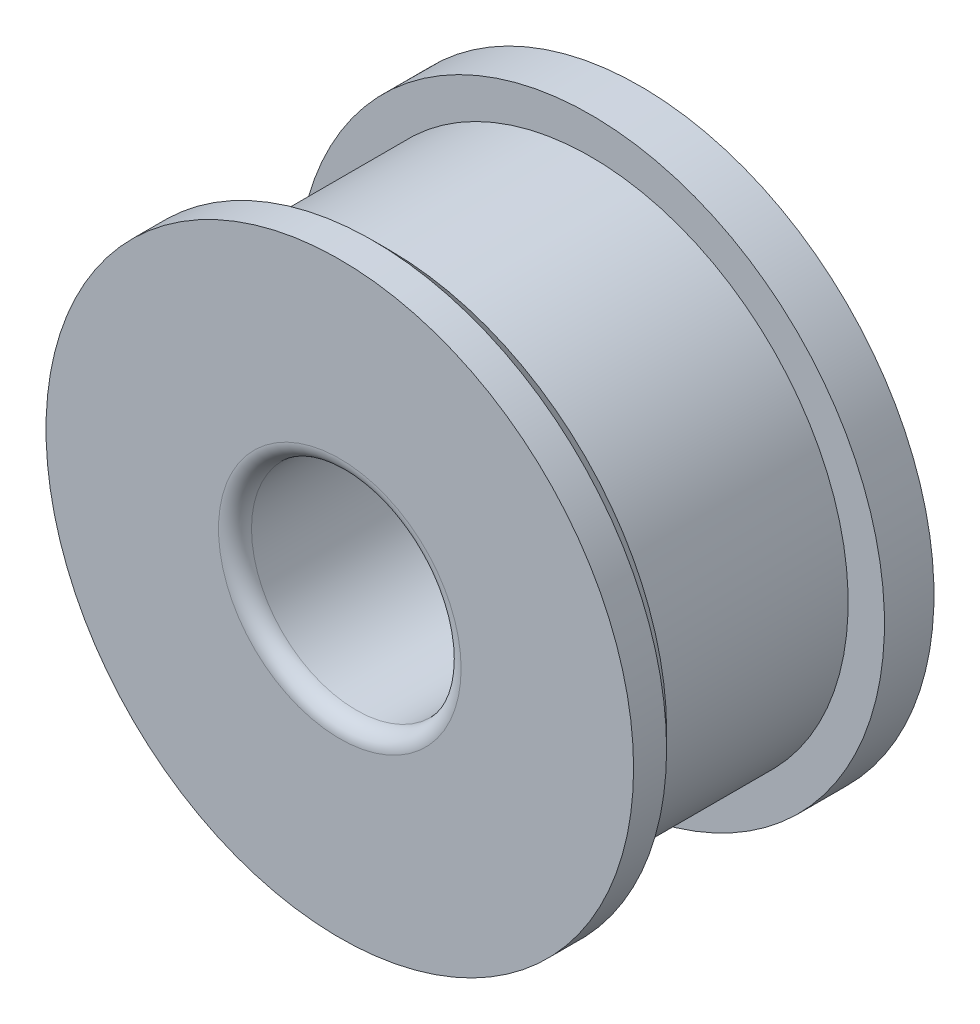
from build123d import *
from OCP.BRepFilletAPI import BRepFilletAPI_MakeChamfer

# Parameters (mm, degrees)
ESBO_O1_W                  = 97.4
ESBO_O1_H                  = 1.25
RESSALTO_EXTRUS_O1_DEPTH   = 6.2
ESBO_O2_W                  = 97.4
ESBO_O2_H                  = 1.25
RESSALTO_EXTRUS_O2_DEPTH   = 40.6
FILETE1_R                  = 1
ESBO_O3_R                  = 2
ESBO_O3_R_2                = 2.5
ESBO_O3_R_3                = 6
ESBO_O3_W                  = 4
ESBO_O3_H                  = 6
ESBO_O3_W_2                = 6
ESBO_O3_H_2                = 8
CORTE_EXTRUS_O1_DEPTH      = 40.6
ESBO_O6_R                  = 3
RESSALTO_EXTRUS_O3_DEPTH   = 22.5
ESBO_O7_R                  = 2.25
RESSALTO_EXTRUS_O4_DEPTH   = 12.3
FILETE2_R                  = 0.25
ESBO_O12_R                 = 4
RESSALTO_EXTRUS_O7_DEPTH   = 3
ESBO_O13_R                 = 4.5
RESSALTO_EXTRUS_O8_DEPTH   = 8.1
ESBO_O8_R                  = 16.365
ESBO_O8_R_2                = 2.3
RESSALTO_EXTRUS_O5_DEPTH   = 4
ESBO_O9_R                  = 4
ESBO_O9_R_2                = 2.3
RESSALTO_EXTRUS_O6_DEPTH   = 8.9
ESBO_O10_R                 = 13.865
ESBO_O10_R_2               = 4.9
CORTE_EXTRUS_O2_DEPTH      = 1
CORTE_EXTRUS_O3_START      = -1
ESBO_O11_R                 = 13.86
ESBO_O11_R_2               = 4.9
CORTE_EXTRUS_O3_DEPTH      = 1
ESBO_O14_R                 = 18.34
ESBO_O14_R_2               = 3.1
RESSALTO_EXTRUS_O9_DEPTH   = 4
ESBO_O15_R                 = 7.8
ESBO_O15_R_2               = 3.1
RESSALTO_EXTRUS_O10_DEPTH  = 11.6
RESSALTO_EXTRUS_O11_START  = -1.5
ESBO_O16_R                 = 8.9
ESBO_O16_R_2               = 3.1
RESSALTO_EXTRUS_O11_DEPTH  = 1.5
CHANFRO1_SIZE              = 0.5
ESBO_O17_R                 = 3.5
ESBO_O17_R_2               = 3.1
RESSALTO_EXTRUS_O12_DEPTH  = 0.5
CORTE_EXTRUS_O4_START      = -1
ESBO_O18_R                 = 15.84
ESBO_O18_R_2               = 8.9
CORTE_EXTRUS_O4_DEPTH      = 1
ESBO_O19_R                 = 15.825
ESBO_O19_R_2               = 8.9
CORTE_EXTRUS_O5_DEPTH      = 1
RESSALTO_EXTRUS_O13_DEPTH  = 0.5
ESBO_O21_R                 = 1.75
RESSALTO_EXTRUS_O14_DEPTH  = 0.92
ESBO_O23_R                 = 17.675026778
RESSALTO_EXTRUS_O15_DEPTH  = 15
FILETE4_R                  = 1
ESBO_O24_R                 = 2.05
ESBO_O24_R_2               = 1.75
RESSALTO_EXTRUS_O16_DEPTH  = 1
ESBO_O25_R                 = 2.5
RESSALTO_EXTRUS_O17_DEPTH  = 0.1
ESBO_O26_R                 = 1
RESSALTO_EXTRUS_O18_DEPTH  = 0.5
FILETE6_R                  = 0.1
ESBO_O27_R                 = 4.99
RESSALTO_EXTRUS_O19_DEPTH  = 16.57
RESSALTO_EXTRUS_O20_START  = -25
ESBO_O28_R                 = 1
RESSALTO_EXTRUS_O20_DEPTH  = 25
FILETE5_R                  = 0.25
ESBO_O29_R                 = 3.59
RESSALTO_EXTRUS_O21_DEPTH  = 6
ESBO_O30_R                 = 2.7
RESSALTO_EXTRUS_O22_DEPTH  = 2
FILETE7_R                  = 1.4
CORTE_EXTRUS_O6_DEPTH      = 1.4
ESBO_O32_R                 = 1.75
RESSALTO_EXTRUS_O23_DEPTH  = 7.8
CHANFRO2_SIZE              = 1
CHANFRO2_SIZE2             = 0.466307658
RESSALTO_EXTRUS_O24_DEPTH  = 10
ESBO_O34_R                 = 2
RESSALTO_EXTRUS_O25_DEPTH  = 5
ESBO_O35_R                 = 7.8
RESSALTO_EXTRUS_O26_DEPTH  = 7.6
ESBO_O37_R                 = 8.9
RESSALTO_EXTRUS_O27_DEPTH  = 1.5
CHANFRO3_SIZE              = 0.5
ESBO_O38_R                 = 8.9
RESSALTO_EXTRUS_O28_DEPTH  = 1.5
CORTE_EXTRUS_O7_DEPTH      = 16
CORTE_EXTRUS_O7_DEPTH_BACK = 35.5
ESBO_O39_R                 = 3.175
FILETE11_R                 = 0.5
FILETE12_R                 = 0.25
FILETE13_R                 = 0.5


with BuildPart() as part:
    # Esboço1 → Ressalto-extrusão1 (new body)
    with BuildSketch(Plane.XY):
        Rectangle(ESBO_O1_W, ESBO_O1_H)
    extrude(amount=RESSALTO_EXTRUS_O1_DEPTH)

    # Esboço2 → Ressalto-extrusão2 (add)
    with BuildSketch(Plane(origin=(0, -0.625, 0), x_dir=(1, 0, 0), z_dir=(0, 1, 0))):
        with Locations((0, -0.625)):
            Rectangle(ESBO_O2_W, ESBO_O2_H)
    extrude(amount=RESSALTO_EXTRUS_O2_DEPTH)

    # Filete1
    filete1_edges = [part.edges().sort_by_distance(p)[0] for p in [
        (48.7, 0, 6.2),
        (48.7, 39.975, 0.625),
        (-48.7, 39.975, 0.625),
        (-48.7, 0, 6.2),
    ]]
    fillet(filete1_edges, radius=FILETE1_R)

    # Esboço3 → Corte-extrusão1 (cut)
    with BuildSketch(Plane.XY.offset(1.25)):
        with Locations((-43.7, 4.975)):
            Circle(ESBO_O3_R)
        with Locations((0, 4.975)):
            Circle(ESBO_O3_R)
        with Locations((38.95, 19.8)):
            Circle(ESBO_O3_R_2)
        with Locations((14.7, 19.8)):
            Circle(ESBO_O3_R_3)
        with Locations((41.7, 30.975)):
            Rectangle(ESBO_O3_W, ESBO_O3_H)
        with Locations((41.7, 8.975)):
            Rectangle(ESBO_O3_W, ESBO_O3_H)
        with Locations((-33.7, 8.975)):
            Rectangle(ESBO_O3_W_2, ESBO_O3_H_2)
        with BuildLine():
            Line((27.7, 36.975), (30.7, 36.975))
            ThreePointArc((30.7, 36.975), (32.7, 34.975), (30.7, 32.975))
            Line((30.7, 32.975), (27.7, 32.975))
            ThreePointArc((27.7, 32.975), (25.7, 34.975), (27.7, 36.975))
        make_face()
        with Locations((-33.7, 30.975)):
            Rectangle(ESBO_O3_W_2, ESBO_O3_H_2)
    extrude(amount=-CORTE_EXTRUS_O1_DEPTH, mode=Mode.SUBTRACT)

    # Esboço6 → Ressalto-extrusão3 (add)
    with BuildSketch(Plane(origin=(0, 0, 0), x_dir=(-1, 0, 0), z_dir=(0, 0, -1))):
        with Locations((25.7, 19.8)):
            Circle(ESBO_O6_R)
    extrude(amount=-RESSALTO_EXTRUS_O3_DEPTH)

    # Esboço7 → Ressalto-extrusão4 (add)
    with BuildSketch(Plane(origin=(0, 0, 0), x_dir=(-1, 0, 0), z_dir=(0, 0, -1))):
        with Locations((4.1, 23.975)):
            Circle(ESBO_O7_R)
    extrude(amount=-RESSALTO_EXTRUS_O4_DEPTH)

    # Filete2
    filete2_edges = [part.edges().sort_by_distance(p)[0] for p in [
        (-22.7, 19.8, 22.5),
        (-1.85, 23.975, 12.3),
    ]]
    fillet(filete2_edges, radius=FILETE2_R)

    # Esboço12 → Ressalto-extrusão7 (add)
    with BuildSketch(Plane.XY):
        with Locations(Location((-4.1, 23.975, 0), (0, 0, 180))):
            Circle(ESBO_O12_R)
    extrude(amount=RESSALTO_EXTRUS_O7_DEPTH)

    # Esboço13 → Ressalto-extrusão8 (add)
    with BuildSketch(Plane(origin=(0, 0, 0), x_dir=(-1, 0, 0), z_dir=(0, 0, -1))):
        with Locations((25.7, 19.8)):
            Circle(ESBO_O13_R)
    extrude(amount=-RESSALTO_EXTRUS_O8_DEPTH)

    # Esboço8 → Ressalto-extrusão5 (add)
    with BuildSketch(Plane.XY.offset(3)):
        with Locations((-4.1, 23.975)):
            Circle(ESBO_O8_R)
        with Locations((-4.1, 23.975)):
            Circle(ESBO_O8_R_2, mode=Mode.SUBTRACT)
    extrude(amount=RESSALTO_EXTRUS_O5_DEPTH)

    # Esboço9 → Ressalto-extrusão6 (add)
    with BuildSketch(Plane.XY.offset(3)):
        with Locations(Location((-4.1, 23.975, 0), (0, 0, 180))):
            Circle(ESBO_O9_R)
        with Locations((-4.1, 23.975)):
            Circle(ESBO_O9_R_2, mode=Mode.SUBTRACT)
    extrude(amount=RESSALTO_EXTRUS_O6_DEPTH)

    # Esboço10 → Corte-extrusão2 (cut)
    with BuildSketch(Plane.XY.offset(7)):
        with Locations((-4.1, 23.975)):
            Circle(ESBO_O10_R)
        with Locations((-4.1, 23.975)):
            Circle(ESBO_O10_R_2, mode=Mode.SUBTRACT)
    extrude(amount=-CORTE_EXTRUS_O2_DEPTH, mode=Mode.SUBTRACT)

    # Esboço11 → Corte-extrusão3 (cut)
    with BuildSketch(Plane(origin=(0, 0, 3), x_dir=(-1, 0, 0), z_dir=(0, 0, -1)).offset(CORTE_EXTRUS_O3_START)):
        with Locations((4.1, 23.975)):
            Circle(ESBO_O11_R)
        with Locations(Location((4.1, 23.975, 0), (0, 0, 180))):
            Circle(ESBO_O11_R_2, mode=Mode.SUBTRACT)
    extrude(amount=CORTE_EXTRUS_O3_DEPTH, mode=Mode.SUBTRACT)

    # Esboço14 → Ressalto-extrusão9 (add)
    with BuildSketch(Plane.XY.offset(8.1)):
        with Locations(Location((-25.7, 19.8, 0), (0, 0, 15.545528491))):
            Circle(ESBO_O14_R)
        with Locations((-25.7, 19.8)):
            Circle(ESBO_O14_R_2, mode=Mode.SUBTRACT)
    extrude(amount=RESSALTO_EXTRUS_O9_DEPTH)

    # Esboço15 → Ressalto-extrusão10 (add)
    with BuildSketch(Plane.XY.offset(8.1)):
        with Locations((-25.7, 19.8)):
            Circle(ESBO_O15_R)
        with Locations((-25.7, 19.8)):
            Circle(ESBO_O15_R_2, mode=Mode.SUBTRACT)
    extrude(amount=RESSALTO_EXTRUS_O10_DEPTH)

    # Esboço16 → Ressalto-extrusão11 (add)
    with BuildSketch(Plane.XY.offset(19.7).offset(RESSALTO_EXTRUS_O11_START)):
        with Locations((-25.7, 19.8)):
            Circle(ESBO_O16_R)
        with Locations((-25.7, 19.8)):
            Circle(ESBO_O16_R_2, mode=Mode.SUBTRACT)
    extrude(amount=RESSALTO_EXTRUS_O11_DEPTH)

    # Chanfro1
    chanfro1_edges = [part.edges().sort_by_distance(p)[0] for p in [
        (-34.6, 19.8, 18.2),
    ]]
    chamfer(chanfro1_edges, length=CHANFRO1_SIZE)

    # Esboço17 → Ressalto-extrusão12 (add)
    with BuildSketch(Plane.XY.offset(19.7)):
        with Locations((-25.7, 19.8)):
            Circle(ESBO_O17_R)
        with Locations((-25.7, 19.8)):
            Circle(ESBO_O17_R_2, mode=Mode.SUBTRACT)
    extrude(amount=RESSALTO_EXTRUS_O12_DEPTH)

    # Esboço18 → Corte-extrusão4 (cut)
    with BuildSketch(Plane.XY.offset(12.1).offset(CORTE_EXTRUS_O4_START)):
        with Locations((-25.7, 19.8)):
            Circle(ESBO_O18_R)
        with Locations((-25.7, 19.8)):
            Circle(ESBO_O18_R_2, mode=Mode.SUBTRACT)
    extrude(amount=CORTE_EXTRUS_O4_DEPTH, mode=Mode.SUBTRACT)

    # Esboço19 → Corte-extrusão5 (cut)
    with BuildSketch(Plane(origin=(0, 0, 8.1), x_dir=(-1, 0, 0), z_dir=(0, 0, -1))):
        with Locations((25.7, 19.8)):
            Circle(ESBO_O19_R)
        with Locations(Location((25.7, 19.8, 0), (0, 0, 180))):
            Circle(ESBO_O19_R_2, mode=Mode.SUBTRACT)
    extrude(amount=-CORTE_EXTRUS_O5_DEPTH, mode=Mode.SUBTRACT)

    # Esboço20 → Ressalto-extrusão13 (add)
    with BuildSketch(Plane.XY.offset(20.2)):
        with BuildLine():
            Line((-28.322721615, 20.626940949), (-29.67498238, 21.05330713))
            ThreePointArc((-29.67498238, 21.05330713), (-29.981119219, 21.326162864), (-29.980184512, 21.736247175))
            ThreePointArc((-29.980184512, 21.736247175), (-28.137076875, 23.816178393), (-25.441102958, 24.490629478))
            ThreePointArc((-25.441102958, 24.490629478), (-25.076922131, 24.302102712), (-24.9762544, 23.904565262))
            Line((-24.9762544, 23.904565262), (-25.222467511, 22.508221321))
            ThreePointArc((-25.222467511, 22.508221321), (-24.430191314, 22.239279791), (-23.755456352, 21.744543648))
            Line((-23.755456352, 21.744543648), (-22.474650348, 23.025349652))
            ThreePointArc((-22.474650348, 23.025349652), (-22.187573749, 23.840156974), (-22.642480013, 24.574584803))
            ThreePointArc((-22.642480013, 24.574584803), (-31.36966388, 19.8), (-22.642480013, 15.025415197))
            ThreePointArc((-22.642480013, 15.025415197), (-22.187573749, 15.759843026), (-22.474650348, 16.574650348))
            Line((-22.474650348, 16.574650348), (-23.755456352, 17.855456352))
            ThreePointArc((-23.755456352, 17.855456352), (-24.430191314, 17.360720209), (-25.222467511, 17.091778679))
            Line((-25.222467511, 17.091778679), (-24.9762544, 15.695434738))
            ThreePointArc((-24.9762544, 15.695434738), (-25.076922131, 15.297897288), (-25.441102958, 15.109370522))
            ThreePointArc((-25.441102958, 15.109370522), (-28.137076875, 15.783821607), (-29.980184512, 17.863752825))
            ThreePointArc((-29.980184512, 17.863752825), (-29.981119219, 18.273837136), (-29.67498238, 18.54669287))
            Line((-29.67498238, 18.54669287), (-28.322721615, 18.973059051))
            ThreePointArc((-28.322721615, 18.973059051), (-28.45, 19.8), (-28.322721615, 20.626940949))
        make_face()
    extrude(amount=RESSALTO_EXTRUS_O13_DEPTH)

    # Esboço21 → Ressalto-extrusão14 (add)
    with BuildSketch(Plane(origin=(0, 0, 0), x_dir=(-1, 0, 0), z_dir=(0, 0, -1))):
        with BuildLine():
            Line((3.595164465, 5.161527392), (2.779555471, 20.88173038))
            ThreePointArc((2.779555471, 20.88173038), (-2.196938457, 32.222448714), (-13.433733778, 37.429349428))
            Line((-13.433733778, 37.429349428), (-29.134017665, 38.565609025))
            ThreePointArc((-29.134017665, 38.565609025), (-31.845866586, 37.610857858), (-32.993876913, 34.975))
            Line((-32.993876913, 34.975), (-32.993876913, 30.076020514))
            Line((-32.993876913, 30.076020514), (-30.487753652, 27.518219171))
            ThreePointArc((-30.487753652, 27.518219171), (-27.196938457, 7.727551286), (-7.477551833, 4.033530282))
            Line((-7.477551833, 4.033530282), (-4.87273477, 1.375))
            Line((-4.87273477, 1.375), (0, 1.375))
            ThreePointArc((0, 1.375), (2.610699007, 2.49624009), (3.595164465, 5.161527392))
        make_face()
        with Locations((0, 4.975)):
            Circle(ESBO_O21_R, mode=Mode.SUBTRACT)
        with Locations((-29.393876913, 34.975)):
            Circle(ESBO_O21_R, mode=Mode.SUBTRACT)
    extrude(amount=RESSALTO_EXTRUS_O14_DEPTH)

    # Esboço23 → Ressalto-extrusão15 (add)
    with BuildSketch(Plane.XY):
        with Locations((14.7, 19.8)):
            Circle(ESBO_O23_R)
    extrude(amount=-RESSALTO_EXTRUS_O15_DEPTH)

    # Filete4
    filete4_edges = [part.edges().sort_by_distance(p)[0] for p in [
        (-2.975026778, 19.8, -15),
    ]]
    fillet(filete4_edges, radius=FILETE4_R)

    # Esboço24 → Ressalto-extrusão16 (add)
    # profile 1 of 2: a face of its own
    with BuildSketch(Plane(origin=(0, 0, -0.92), x_dir=(-1, 0, 0), z_dir=(0, 0, -1))):
        with Locations((0, 4.975)):
            Circle(ESBO_O24_R)
        with Locations((0, 4.975)):
            Circle(ESBO_O24_R_2, mode=Mode.SUBTRACT)
    # profile 2 of 2: a face of its own
    with BuildSketch(Plane(origin=(0, 0, -0.92), x_dir=(-1, 0, 0), z_dir=(0, 0, -1))):
        with Locations((-29.393876913, 34.975)):
            Circle(ESBO_O24_R)
        with Locations((-29.393876913, 34.975)):
            Circle(ESBO_O24_R_2, mode=Mode.SUBTRACT)
    extrude(amount=RESSALTO_EXTRUS_O16_DEPTH)

    # Esboço25 → Ressalto-extrusão17 (add)
    with BuildSketch(Plane(origin=(0, 0, -15), x_dir=(-1, 0, 0), z_dir=(0, 0, -1))):
        with Locations(Location((-14.7, 19.8, 0), (0, 0, 180))):
            Circle(ESBO_O25_R)
    extrude(amount=RESSALTO_EXTRUS_O17_DEPTH)

    # Esboço26 → Ressalto-extrusão18 (add)
    with BuildSketch(Plane(origin=(0, 0, -15.1), x_dir=(-1, 0, 0), z_dir=(0, 0, -1))):
        with Locations((-14.7, 19.8)):
            Circle(ESBO_O26_R)
    extrude(amount=RESSALTO_EXTRUS_O18_DEPTH)

    # Filete6
    filete6_edges = [part.edges().sort_by_distance(p)[0] for p in [
        (12.2, 19.8, -15.1),
    ]]
    fillet(filete6_edges, radius=FILETE6_R - 0.0001)  # a hair under: the kernel refuses the full size

    # Esboço27 → Ressalto-extrusão19 (add)
    with BuildSketch(Plane.XY.offset(-15)):
        with Locations(Location((14.7, 19.8, 0), (0, 0, 180))):
            Circle(ESBO_O27_R)
    extrude(amount=RESSALTO_EXTRUS_O19_DEPTH)

    # Esboço28 → Ressalto-extrusão20 (add)
    with BuildSketch(Plane(origin=(0, 0, -15.6), x_dir=(-1, 0, 0), z_dir=(0, 0, -1)).offset(RESSALTO_EXTRUS_O20_START)):
        with Locations((-14.7, 19.8)):
            Circle(ESBO_O28_R)
    extrude(amount=RESSALTO_EXTRUS_O20_DEPTH)

    # Filete5
    filete5_edges = [part.edges().sort_by_distance(p)[0] for p in [
        (15.7, 19.8, -15.6),
        (15.7, 19.8, 9.4),
    ]]
    fillet(filete5_edges, radius=FILETE5_R)

    # Esboço29 → Ressalto-extrusão21 (add)
    with BuildSketch(Plane.XY.offset(9.15)):
        with Locations((14.7, 19.8)):
            Circle(ESBO_O29_R)
    extrude(amount=-RESSALTO_EXTRUS_O21_DEPTH)

    # Esboço30 → Ressalto-extrusão22 (add)
    with BuildSketch(Plane.XY.offset(1.25)):
        with Locations(Location((0, 4.975, 0), (0, 0, 180))):
            Circle(ESBO_O30_R)
        with Locations(Location((29.393876913, 34.975, 0), (0, 0, 227.672748848))):
            Circle(ESBO_O30_R)
    extrude(amount=RESSALTO_EXTRUS_O22_DEPTH)

    # Filete7
    filete7_edges = [part.edges().sort_by_distance(p)[0] for p in [
        (2.7, 4.975, 3.25),
        (31.211960314, 36.971139461, 3.25),
    ]]
    fillet(filete7_edges, radius=FILETE7_R)

    # Esboço31 → Corte-extrusão6 (cut)
    with BuildSketch(Plane.XY.offset(3.25)):
        with BuildLine():
            Line((29.093876913, 37.175), (29.693876913, 37.175))
            ThreePointArc((29.693876913, 37.175), (29.83529827, 37.116421356), (29.893876913, 36.975))
            Line((29.893876913, 36.975), (29.893876913, 35.975))
            ThreePointArc((29.893876913, 35.975), (30.040323523, 35.621446609), (30.393876913, 35.475))
            Line((30.393876913, 35.475), (31.393876913, 35.475))
            ThreePointArc((31.393876913, 35.475), (31.53529827, 35.416421356), (31.593876913, 35.275))
            Line((31.593876913, 35.275), (31.593876913, 34.675))
            ThreePointArc((31.593876913, 34.675), (31.53529827, 34.533578644), (31.393876913, 34.475))
            Line((31.393876913, 34.475), (30.393876913, 34.475))
            ThreePointArc((30.393876913, 34.475), (30.040323523, 34.328553391), (29.893876913, 33.975))
            Line((29.893876913, 33.975), (29.893876913, 32.975))
            ThreePointArc((29.893876913, 32.975), (29.83529827, 32.833578644), (29.693876913, 32.775))
            Line((29.693876913, 32.775), (29.093876913, 32.775))
            ThreePointArc((29.093876913, 32.775), (28.952455557, 32.833578644), (28.893876913, 32.975))
            Line((28.893876913, 32.975), (28.893876913, 33.975))
            ThreePointArc((28.893876913, 33.975), (28.747430304, 34.328553391), (28.393876913, 34.475))
            Line((28.393876913, 34.475), (27.393876913, 34.475))
            ThreePointArc((27.393876913, 34.475), (27.252455557, 34.533578644), (27.193876913, 34.675))
            Line((27.193876913, 34.675), (27.193876913, 35.275))
            ThreePointArc((27.193876913, 35.275), (27.252455557, 35.416421356), (27.393876913, 35.475))
            Line((27.393876913, 35.475), (28.393876913, 35.475))
            ThreePointArc((28.393876913, 35.475), (28.747430304, 35.621446609), (28.893876913, 35.975))
            Line((28.893876913, 35.975), (28.893876913, 36.975))
            ThreePointArc((28.893876913, 36.975), (28.952455557, 37.116421356), (29.093876913, 37.175))
        make_face()
        with BuildLine():
            Line((-0.142061447, 7.325028719), (0.457938553, 7.325028719))
            ThreePointArc((0.457938553, 7.325028719), (0.59935991, 7.266450075), (0.657938553, 7.125028719))
            Line((0.657938553, 7.125028719), (0.657938553, 6.125028719))
            ThreePointArc((0.657938553, 6.125028719), (0.804385163, 5.771475328), (1.157938553, 5.625028719))
            Line((1.157938553, 5.625028719), (2.157938553, 5.625028719))
            ThreePointArc((2.157938553, 5.625028719), (2.29935991, 5.566450075), (2.357938553, 5.425028719))
            Line((2.357938553, 5.425028719), (2.357938553, 4.825028719))
            ThreePointArc((2.357938553, 4.825028719), (2.29935991, 4.683607363), (2.157938553, 4.625028719))
            Line((2.157938553, 4.625028719), (1.157938553, 4.625028719))
            ThreePointArc((1.157938553, 4.625028719), (0.804385163, 4.478582109), (0.657938553, 4.125028719))
            Line((0.657938553, 4.125028719), (0.657938553, 3.125028719))
            ThreePointArc((0.657938553, 3.125028719), (0.59935991, 2.983607363), (0.457938553, 2.925028719))
            Line((0.457938553, 2.925028719), (-0.142061447, 2.925028719))
            ThreePointArc((-0.142061447, 2.925028719), (-0.283482803, 2.983607363), (-0.342061447, 3.125028719))
            Line((-0.342061447, 3.125028719), (-0.342061447, 4.125028719))
            ThreePointArc((-0.342061447, 4.125028719), (-0.488508056, 4.478582109), (-0.842061447, 4.625028719))
            Line((-0.842061447, 4.625028719), (-1.842061447, 4.625028719))
            ThreePointArc((-1.842061447, 4.625028719), (-1.983482803, 4.683607363), (-2.042061447, 4.825028719))
            Line((-2.042061447, 4.825028719), (-2.042061447, 5.425028719))
            ThreePointArc((-2.042061447, 5.425028719), (-1.983482803, 5.566450075), (-1.842061447, 5.625028719))
            Line((-1.842061447, 5.625028719), (-0.842061447, 5.625028719))
            ThreePointArc((-0.842061447, 5.625028719), (-0.488508056, 5.771475328), (-0.342061447, 6.125028719))
            Line((-0.342061447, 6.125028719), (-0.342061447, 7.125028719))
            ThreePointArc((-0.342061447, 7.125028719), (-0.283482803, 7.266450075), (-0.142061447, 7.325028719))
        make_face()
    extrude(amount=-CORTE_EXTRUS_O6_DEPTH, mode=Mode.SUBTRACT)

    # Esboço32 → Ressalto-extrusão23 (add)
    with BuildSketch(Plane(origin=(0, 0, 1.25), x_dir=(-1, 0, 0), z_dir=(0, 0, -1))):
        with Locations((0, 4.975)):
            Circle(ESBO_O32_R)
        with Locations(Location((-29.393876913, 34.975, 0), (0, 0, 180))):
            Circle(ESBO_O32_R)
    extrude(amount=RESSALTO_EXTRUS_O23_DEPTH)

    # Chanfro2: one chamfer whose edges measure the first distance from different faces: ONE call of the kernel's chamfer builder (chamfer() names one face for all edges)
    chanfro2_edges_1 = [part.edges().sort_by_distance(p)[0] for p in [
        (1.75, 4.975, -6.55),
    ]]
    chanfro2_side_1 = [part.faces().sort_by_distance(p)[0] for p in [
        (1.75, 4.975, -4.235),
    ]]
    chanfro2_edges_2 = [part.edges().sort_by_distance(p)[0] for p in [
        (27.643876913, 34.975, -6.55),
    ]]
    chanfro2_side_2 = [part.faces().sort_by_distance(p)[0] for p in [
        (27.643876913, 34.975, -4.235),
    ]]
    chanfro2 = BRepFilletAPI_MakeChamfer(part.part.solid().wrapped)
    for e in chanfro2_edges_1:
        chanfro2.Add(CHANFRO2_SIZE, CHANFRO2_SIZE2, e.wrapped, chanfro2_side_1[0].wrapped)  # the first distance lies on this face
    for e in chanfro2_edges_2:
        chanfro2.Add(CHANFRO2_SIZE, CHANFRO2_SIZE2, e.wrapped, chanfro2_side_2[0].wrapped)  # the first distance lies on this face
    add(Compound.cast(chanfro2.Shape()), mode=Mode.REPLACE)

    # Esboço33 → Ressalto-extrusão24 (add)
    with BuildSketch(Plane(origin=(0, 0, -0.92), x_dir=(-1, 0, 0), z_dir=(0, 0, -1))):
        with BuildLine():
            Line((3.196311276, 12.849099671), (3.224269109, 12.846096875))
            Line((3.224269109, 12.846096875), (4.292171901, 22.788912554))
            Line((4.292171901, 22.788912554), (2.690076099, 22.960984796))
            ThreePointArc((2.690076099, 22.960984796), (2.95476648, 20.646044994), (2.912651997, 18.316402606))
            Line((2.912651997, 18.316402606), (3.196311276, 12.849099671))
        make_face()
        with BuildLine():
            Line((1.622173307, 13.018169117), (3.196311276, 12.849099671))
            Line((3.196311276, 12.849099671), (2.912651997, 18.316402606))
            ThreePointArc((2.912651997, 18.316402606), (2.472970379, 15.617218633), (1.622173307, 13.018169117))
        make_face()
    extrude(amount=RESSALTO_EXTRUS_O24_DEPTH)

    # Esboço34 → Ressalto-extrusão25 (add)
    with BuildSketch(Plane(origin=(-1.823505509, -0.195852632, 0), x_dir=(0, 0, 1), z_dir=(-0.9942815679049348, -0.10679027916671441, 0))):
        with Locations(Location((-5.92, 18.116957941, 0), (0, 0, 270))):
            Circle(ESBO_O34_R)
    extrude(amount=RESSALTO_EXTRUS_O25_DEPTH)

    # Filete11
    filete11_edges = [part.edges().sort_by_distance(p)[0] for p in [
        (0, -0.625, 0),
    ]]
    fillet(filete11_edges, radius=FILETE11_R)

    # Filete12
    filete12_edges = [part.edges().sort_by_distance(p)[0] for p in [
        (0, 0.625, 1.25),
    ]]
    fillet(filete12_edges, radius=FILETE12_R)


with BuildPart() as body_2:
    # Esboço35 → Ressalto-extrusão26 (new body)
    with BuildSketch(Plane.XY.offset(12.1)):
        with Locations(Location((-398.7, 19.8, 0), (0, 0, 180))):
            Circle(ESBO_O35_R)
    extrude(amount=RESSALTO_EXTRUS_O26_DEPTH)

    # Esboço37 → Ressalto-extrusão27 (add)
    with BuildSketch(Plane.XY.offset(19.7)):
        with Locations((-398.7, 19.8)):
            Circle(ESBO_O37_R)
    extrude(amount=-RESSALTO_EXTRUS_O27_DEPTH)

    # Chanfro3
    chanfro3_edges = [body_2.edges().sort_by_distance(p)[0] for p in [
        (-407.6, 19.8, 18.2),
    ]]
    chamfer(chanfro3_edges, length=CHANFRO3_SIZE)

    # Esboço38 → Ressalto-extrusão28 (add)
    with BuildSketch(Plane(origin=(0, 0, 12.1), x_dir=(-1, 0, 0), z_dir=(0, 0, -1))):
        with Locations(Location((398.7, 19.8, 0), (0, 0, 180))):
            Circle(ESBO_O38_R)
    extrude(amount=RESSALTO_EXTRUS_O28_DEPTH)

    # Esboço39 → Corte-extrusão7 (cut, two sides: drawn at the far end of the back side and taken through both)
    with BuildSketch(Plane.XY.offset(19.7).offset(-CORTE_EXTRUS_O7_DEPTH_BACK)):
        with Locations(Location((-398.7, 19.8, 0), (0, 0, 180))):
            Circle(ESBO_O39_R)
    extrude(amount=CORTE_EXTRUS_O7_DEPTH + CORTE_EXTRUS_O7_DEPTH_BACK, mode=Mode.SUBTRACT)

    # Filete13
    filete13_edges = [body_2.edges().sort_by_distance(p)[0] for p in [
        (-395.525, 19.8, 19.7),
        (-395.525, 19.8, 10.6),
    ]]
    fillet(filete13_edges, radius=FILETE13_R)


solid = body_2.part
